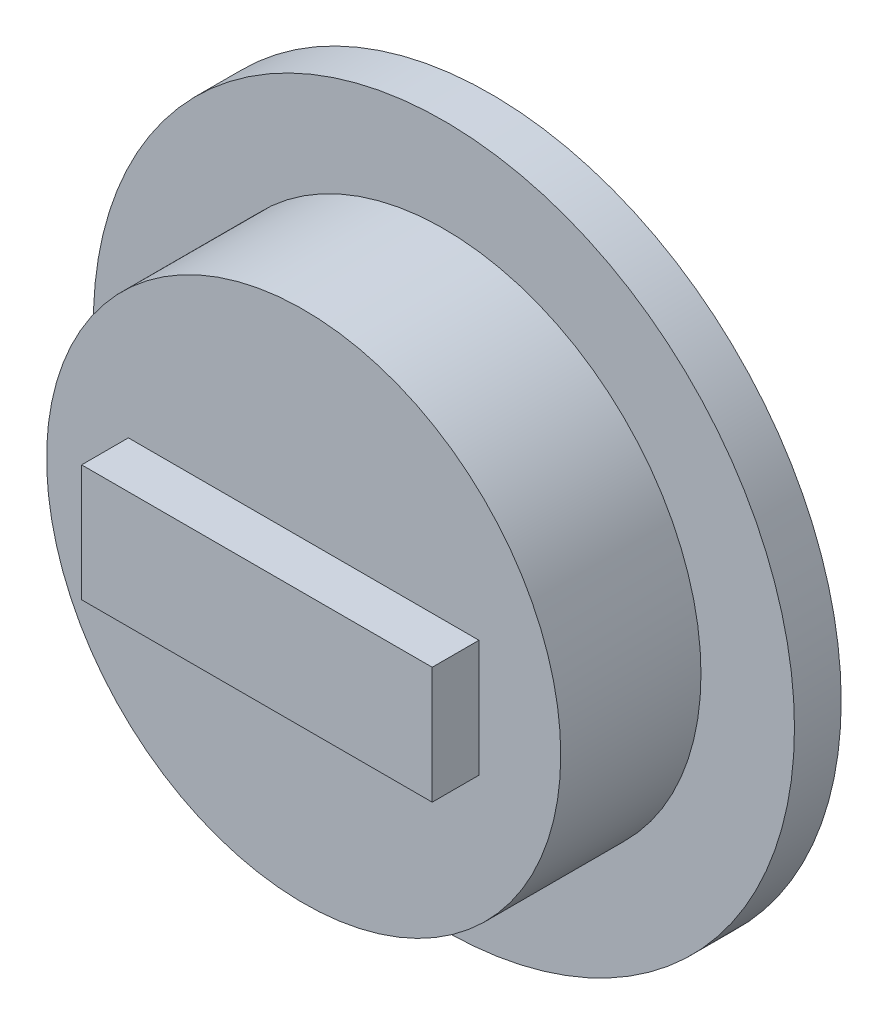
from build123d import *

# Parameters (mm, degrees)
SKETCH_1_R          = 15
EXTRUDE_1_DEPTH     = 2
EXTRUDE_START       = 2
SKETCH_2_R          = 11
EXTRUDE_2_DEPTH     = 6
SKETCH_3_W          = 15
SKETCH_3_H          = 5
EXTRUDE_3_DEPTH     = 10
SKETCH_4_W          = 15
SKETCH_4_H          = 4
CUT_EXTRUDE_1_DEPTH = 4


with BuildPart() as part:
    # Эскиз1 → Бобышка-Вытянуть1 (new body)
    with BuildSketch(Plane.XY):
        Circle(SKETCH_1_R)
    extrude(amount=EXTRUDE_1_DEPTH)

    # Эскиз2 → Бобышка-Вытянуть2 (add)
    with BuildSketch(Plane.XY.offset(EXTRUDE_START)):
        Circle(SKETCH_2_R)
    extrude(amount=EXTRUDE_2_DEPTH)

    # Эскиз3 → Бобышка-Вытянуть3 (add)
    with BuildSketch(Plane.XY):
        Rectangle(SKETCH_3_W, SKETCH_3_H)
    extrude(amount=EXTRUDE_3_DEPTH)

    # Эскиз4 → Вырез-Вытянуть1 (cut)
    with BuildSketch(Plane.XY):
        with Locations((0, 4)):
            Rectangle(SKETCH_4_W, SKETCH_4_H)
        with Locations((0, -4)):
            Rectangle(SKETCH_4_W, SKETCH_4_H)
    extrude(amount=CUT_EXTRUDE_1_DEPTH, mode=Mode.SUBTRACT)


solid = part.part
